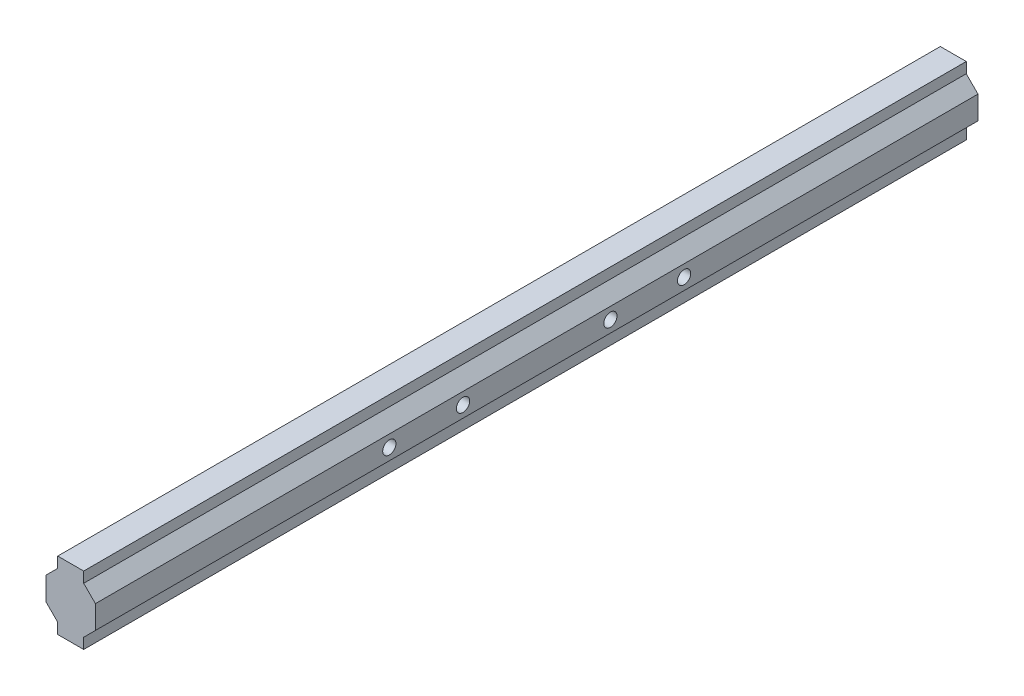
from build123d import *

# Parameters (mm, degrees)
BOSS_EXTRUDE1_DEPTH = 200
SKETCH2_R           = 1.5
CUT_EXTRUDE1_DEPTH  = 20


with BuildPart() as part:
    # Sketch1 → Boss-Extrude1 (new body)
    with BuildSketch(Plane.XY.offset(116.106580091)):
        Polygon((-39.550290087, 5.294235639), (-36.889629915, 7.954895811), (-36.889629915, 10.362002592), (-31.010950259, 10.362002592), (-31.010950259, 7.954895811), (-28.350290087, 5.294235639), (-28.350290087, 0.029769545), (-31.010950259, -2.630890626), (-31.010950259, -5.037997408), (-36.889629915, -5.037997408), (-36.889629915, -2.630890626), (-39.550290087, 0.029769545), align=None)
    extrude(amount=BOSS_EXTRUDE1_DEPTH)

    # Sketch2 → Cut-Extrude1 (cut)
    with BuildSketch(Plane(origin=(-28.350290087, 0, 0), x_dir=(0, 0, -1), z_dir=(1, 0, 0))):
        with Locations((-249.506580091, 2.662002592)):
            Circle(SKETCH2_R)
        with Locations((-232.806580091, 2.662002592)):
            Circle(SKETCH2_R)
        with Locations((-199.406580091, 2.662002592)):
            Circle(SKETCH2_R)
        with Locations((-182.706580091, 2.662002592)):
            Circle(SKETCH2_R)
    extrude(amount=-CUT_EXTRUDE1_DEPTH, mode=Mode.SUBTRACT)


solid = part.part
